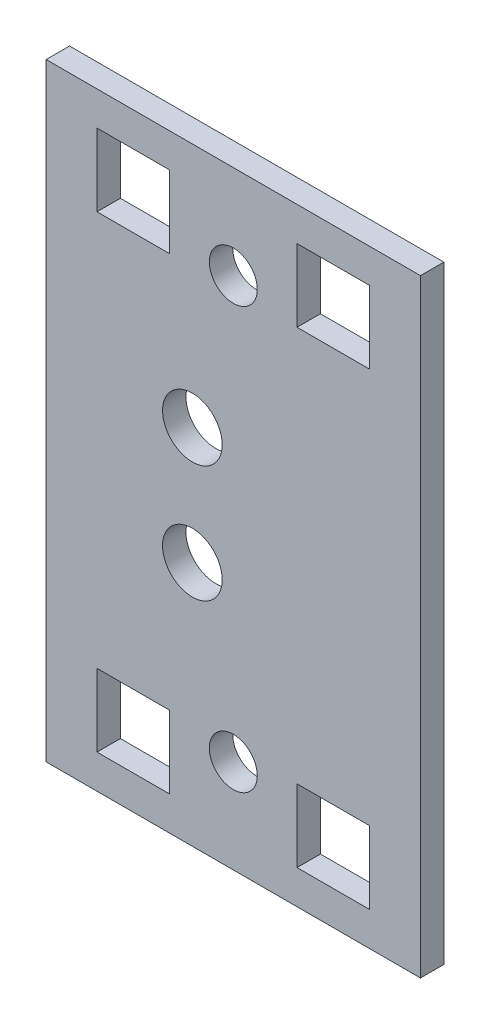
from build123d import *

# Parameters (mm, degrees)
SKETCH_1_W      = 32
SKETCH_1_H      = 52
SKETCH_1_R      = 2.55
SKETCH_1_R_2    = 2.05
SKETCH_1_W_2    = 6.2
SKETCH_1_H_2    = 6.2
EXTRUDE_1_DEPTH = 2


with BuildPart() as part:
    # 草图1 → 凸台-拉伸1 (new body)
    with BuildSketch(Plane.XY):
        with Locations((38.129788434, 0)):
            Rectangle(SKETCH_1_W, SKETCH_1_H)
        with Locations((34.629788434, 5)):
            Circle(SKETCH_1_R, mode=Mode.SUBTRACT)
        with Locations((38.129788434, -18)):
            Circle(SKETCH_1_R_2, mode=Mode.SUBTRACT)
        with Locations((34.629788434, -5)):
            Circle(SKETCH_1_R, mode=Mode.SUBTRACT)
        with Locations((38.129788434, 18)):
            Circle(SKETCH_1_R_2, mode=Mode.SUBTRACT)
        with Locations((46.679788434, -20)):
            Rectangle(SKETCH_1_W_2, SKETCH_1_H_2, mode=Mode.SUBTRACT)
        with Locations((29.579788434, -20)):
            Rectangle(SKETCH_1_W_2, SKETCH_1_H_2, mode=Mode.SUBTRACT)
        with Locations((29.579788434, 20)):
            Rectangle(SKETCH_1_W_2, SKETCH_1_H_2, mode=Mode.SUBTRACT)
        with Locations((46.679788434, 20)):
            Rectangle(SKETCH_1_W_2, SKETCH_1_H_2, mode=Mode.SUBTRACT)
    extrude(amount=EXTRUDE_1_DEPTH)


solid = part.part
